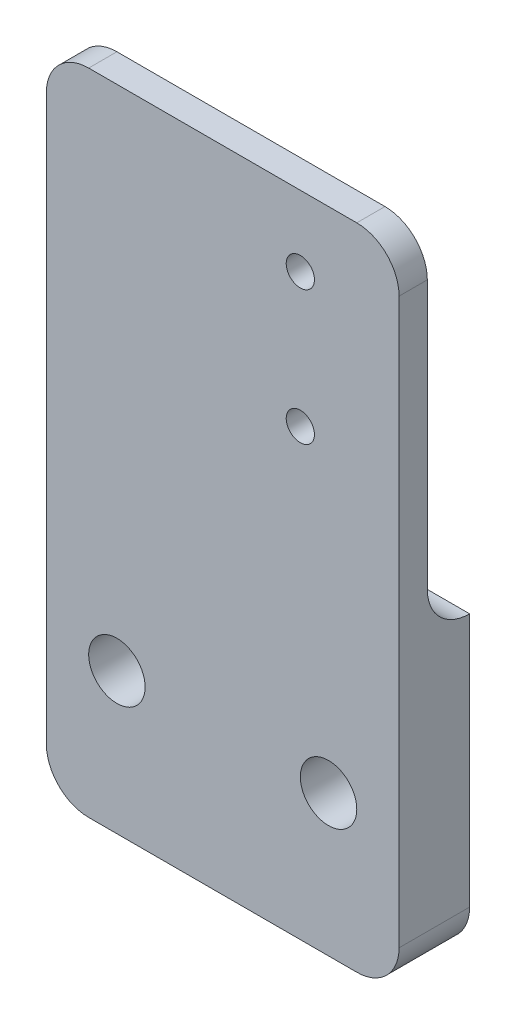
from build123d import *

# Parameters (mm, degrees)
SKETCH_1_W          = 25
SKETCH_1_H          = 46
EXTRUDE_1_DEPTH     = 5
SKETCH_2_W          = 25
SKETCH_2_H          = 25
CUT_EXTRUDE_1_DEPTH = 3
M4X0_7_1_D          = 4
M2X0_4_1_D          = 2
FILLET_1_R          = 3
FILLET_2_R          = 3


with BuildPart() as part:
    # ｽｹｯﾁ1 → ﾎﾞｽ - 押し出し1 (new body)
    with BuildSketch(Plane.XY):
        with Locations((12.5, 23)):
            Rectangle(SKETCH_1_W, SKETCH_1_H)
    extrude(amount=EXTRUDE_1_DEPTH)

    # ｽｹｯﾁ2 → ｶｯﾄ - 押し出し1 (cut)
    with BuildSketch(Plane(origin=(0, 0, 0), x_dir=(-1, 0, 0), z_dir=(0, 0, -1))):
        with Locations((-12.5, 33.5)):
            Rectangle(SKETCH_2_W, SKETCH_2_H)
    extrude(amount=-CUT_EXTRUDE_1_DEPTH, mode=Mode.SUBTRACT)

    # M4x0.7 ねじ穴1 (through all)
    with Locations(Plane.XY.offset(5)):
        with Locations((5, 10), (20, 10)):
            Hole(M4X0_7_1_D / 2)

    # M2x0.4 ねじ穴1 (through all)
    with Locations(Plane.XY.offset(5)):
        with Locations((18, 41), (18, 31.5)):
            Hole(M2X0_4_1_D / 2)

    # ﾌｨﾚｯﾄ1
    fillet_1_edges = [part.edges().sort_by_distance(p)[0] for p in [
        (12.5, 21, 3),
    ]]
    fillet(fillet_1_edges, radius=FILLET_1_R - 0.0001)  # a hair under: the kernel refuses the full size

    # ﾌｨﾚｯﾄ2
    fillet_2_edges = [part.edges().sort_by_distance(p)[0] for p in [
        (0, 46, 4),
        (25, 46, 4),
        (25, 0, 2.5),
        (0, 0, 2.5),
    ]]
    fillet(fillet_2_edges, radius=FILLET_2_R)


solid = part.part
